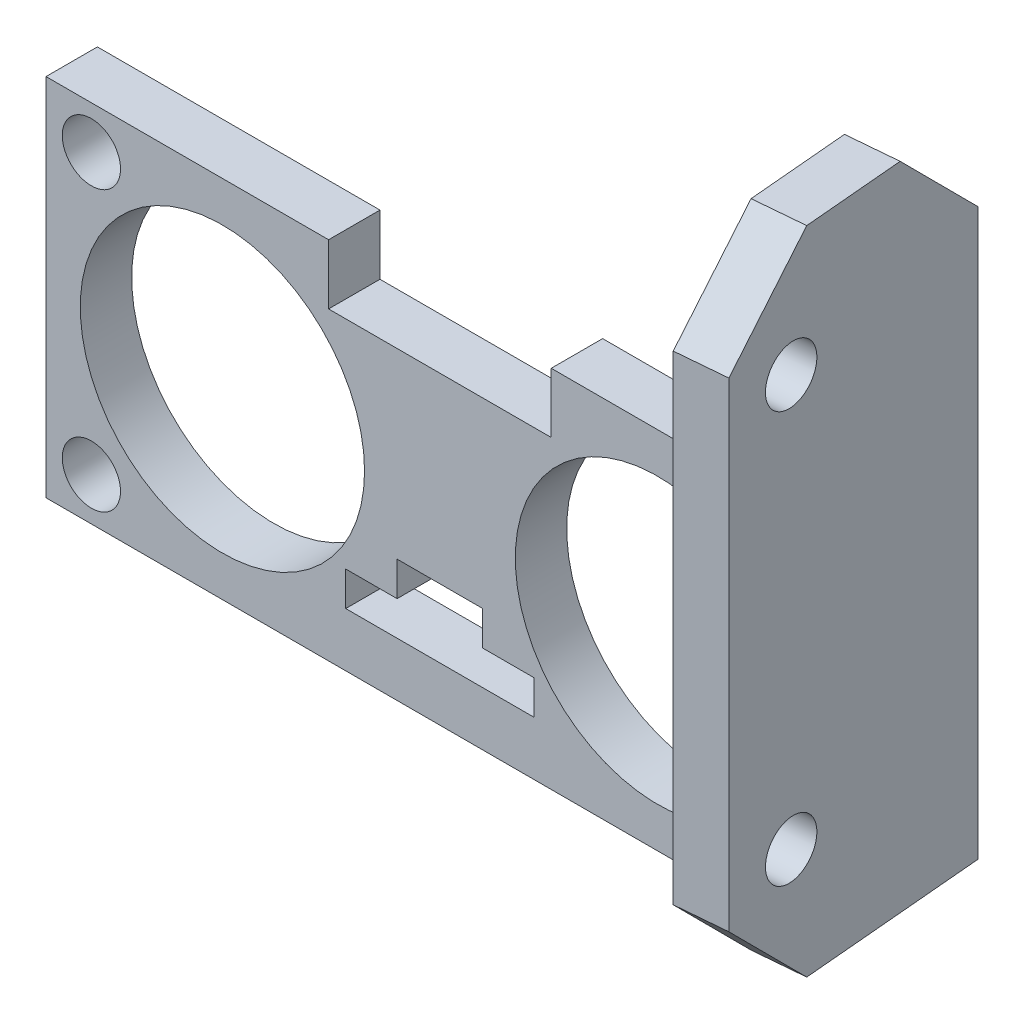
from build123d import *

# Parameters (mm, degrees)
SKETCH_1_W          = 46
SKETCH_1_H          = 21.3
EXTRUDE_1_DEPTH     = 3
SKETCH_2_R          = 8.3
CUT_EXTRUDE_1_DEPTH = 26.522979842
SKETCH_3_W          = 8
SKETCH_3_H          = 3
CUT_EXTRUDE_2_DEPTH = 26.522979842
SKETCH_4_W          = 5
SKETCH_4_H          = 4
CUT_EXTRUDE_3_DEPTH = 26.522979842
SKETCH_5_W          = 3
SKETCH_5_H          = 2
SKETCH_5_W_2        = 2
SKETCH_5_H_2        = 3
CUT_EXTRUDE_4_DEPTH = 1
HOLE_WIZARD_M3_1_D  = 3.4
SKETCH4_W           = 11
SKETCH4_H           = 2
SKETCH4_W_2         = 13
SKETCH4_H_2         = 3.5
CUT_EXTRUDE3_DEPTH  = 26.522979842
BOSS_EXTRUDE2_DEPTH = 21.3
SKETCH7_W           = 3.011459513
SKETCH7_H           = 21.3
BOSS_EXTRUDE3_DEPTH = 2
SKETCH10_W          = 2
SKETCH10_H          = 28.7
BOSS_EXTRUDE5_DEPTH = 3.011459513
CUT_EXTRUDE6_DEPTH  = 47.808991188
SKETCH14_W          = 16
SKETCH14_H          = 38
BOSS_EXTRUDE8_DEPTH = 3
CHAMFER2_SIZE       = 2
SKETCH15_R          = 1.65
CUT_EXTRUDE7_DEPTH  = 61.720869721
CHAMFER3_SIZE       = 5


with BuildPart() as part:
    # 草圖1 → 填料-伸長1 (new body)
    with BuildSketch(Plane.XY):
        Rectangle(SKETCH_1_W, SKETCH_1_H)
    extrude(amount=EXTRUDE_1_DEPTH)

    # 草圖2 → 除料-伸長1 (cut, through all)
    with BuildSketch(Plane.XY.offset(3)):
        with Locations((-12.7, 0)):
            Circle(SKETCH_2_R)
        with Locations((12.7, 0)):
            Circle(SKETCH_2_R)
    extrude(amount=-CUT_EXTRUDE_1_DEPTH, mode=Mode.SUBTRACT)

    # 草圖3 → 除料-伸長2 (cut, through all)
    with BuildSketch(Plane.XY.offset(3)):
        with Locations((0, 9.15)):
            Rectangle(SKETCH_3_W, SKETCH_3_H)
    extrude(amount=-CUT_EXTRUDE_2_DEPTH, mode=Mode.SUBTRACT)

    # 草圖4 → 除料-伸長3 (cut, through all)
    with BuildSketch(Plane.XY.offset(3)):
        with Locations((0, -5.5)):
            Rectangle(SKETCH_4_W, SKETCH_4_H)
    extrude(amount=-CUT_EXTRUDE_3_DEPTH, mode=Mode.SUBTRACT)

    # 草圖5 → 除料-伸長4 (cut)
    with BuildSketch(Plane.XY.offset(3)):
        with Locations((4, -6.5)):
            Rectangle(SKETCH_5_W, SKETCH_5_H)
        with Locations((-5.5, 8.65)):
            Rectangle(SKETCH_5_W_2, SKETCH_5_H_2)
        with Locations((5.5, 8.65)):
            Rectangle(SKETCH_5_W_2, SKETCH_5_H_2)
        with Locations((-4, -6.5)):
            Rectangle(SKETCH_5_W, SKETCH_5_H)
    extrude(amount=-CUT_EXTRUDE_4_DEPTH, mode=Mode.SUBTRACT)

    # M3 餘隙孔1 (through all)
    with Locations(Plane.XY.offset(3)):
        with Locations((20.35, 8.15), (-20.35, -8.15), (-20.35, 8.15), (20.35, -8.15)):
            Hole(HOLE_WIZARD_M3_1_D / 2)

    # Sketch4 → Cut-Extrude3 (cut, through all)
    with BuildSketch(Plane.XY.offset(3)):
        with Locations((0, -6.5)):
            Rectangle(SKETCH4_W, SKETCH4_H)
        with Locations((0, 8.9)):
            Rectangle(SKETCH4_W_2, SKETCH4_H_2)
    extrude(amount=-CUT_EXTRUDE3_DEPTH, mode=Mode.SUBTRACT)

    # Sketch5 → Boss-Extrude2 (add)
    with BuildSketch(Plane(origin=(0, -10.65, 0), x_dir=(-1, 0, 0), z_dir=(0, -1, 0))):
        Polygon((-23, 0), (-23, -3), (-23.262465991, -3), align=None)
    extrude(amount=-BOSS_EXTRUDE2_DEPTH)

    # Sketch7 → Boss-Extrude3 (add)
    with BuildSketch(Plane(origin=(22.82528916, 0, -1.996954043), x_dir=(-0.08715574274765041, 0, -0.9961946980917462), z_dir=(0.9961946980917462, 0, -0.08715574274765041))):
        with Locations((-3.510311839, 0)):
            Rectangle(SKETCH7_W, SKETCH7_H)
    extrude(amount=BOSS_EXTRUDE3_DEPTH)

    # Sketch10 → Boss-Extrude5 (add)
    with BuildSketch(Plane(origin=(0.437176831, 0, 4.996954043), x_dir=(0.9961946980917463, 0, -0.08715574274765044), z_dir=(0.08715574274765044, 0, 0.9961946980917463))):
        with Locations((23.912478056, 25)):
            Rectangle(SKETCH10_W, SKETCH10_H)
    extrude(amount=-BOSS_EXTRUDE5_DEPTH)

    # Sketch12 → Cut-Extrude6 (cut, through all)
    with BuildSketch(Plane(origin=(0.437176831, 0, 4.996954043), x_dir=(0.9961946980917463, 0, -0.08715574274765044), z_dir=(0.08715574274765044, 0, 0.9961946980917463))):
        Polygon((24.912478056, -5.155045161), (22.912478056, -10.65), (24.912478056, -10.65), align=None)
        Polygon((22.912478056, 39.35), (22.912478056, 10.65), (24.912478056, 16.144954839), (24.912478056, 39.35), align=None)
    extrude(amount=-CUT_EXTRUDE6_DEPTH, mode=Mode.SUBTRACT)

    # Sketch14 → Boss-Extrude8 (add)
    with BuildSketch(Plane(origin=(24.817678556, 0, -2.171265529), x_dir=(-0.08715574274765041, 0, -0.9961946980917462), z_dir=(0.9961946980917462, 0, -0.08715574274765041))):
        with Locations((-10.004582083, 13.844954839)):
            Rectangle(SKETCH14_W, SKETCH14_H)
    extrude(amount=BOSS_EXTRUDE8_DEPTH)

    # Chamfer2
    chamfer2_edges = [part.edges().sort_by_distance(p)[0] for p in [
        (25.254855387, 5.494954839, 2.825688515),
    ]]
    chamfer(chamfer2_edges, length=CHAMFER2_SIZE - 0.0001)  # a hair under: the kernel refuses the full size

    # Sketch15 → Cut-Extrude7 (cut, through all)
    with BuildSketch(Plane(origin=(24.817678556, 0, -2.171265529), x_dir=(0.08715574274765048, 0, 0.9961946980917462), z_dir=(-0.9961946980917462, 0, 0.08715574274765048))):
        with Locations((14.004582083, 25.844954839)):
            Circle(SKETCH15_R)
        with Locations((14.004582083, 1.844954839)):
            Circle(SKETCH15_R)
    extrude(amount=-CUT_EXTRUDE7_DEPTH, mode=Mode.SUBTRACT)

    # Chamfer3
    chamfer3_edges = [part.edges().sort_by_distance(p)[0] for p in [
        (26.486681443, 32.844954839, -0.3050451),
        (27.881173327, 32.844954839, 15.63407007),
        (27.881173327, -5.155045161, 15.63407007),
    ]]
    chamfer(chamfer3_edges, length=CHAMFER3_SIZE)


solid = part.part
